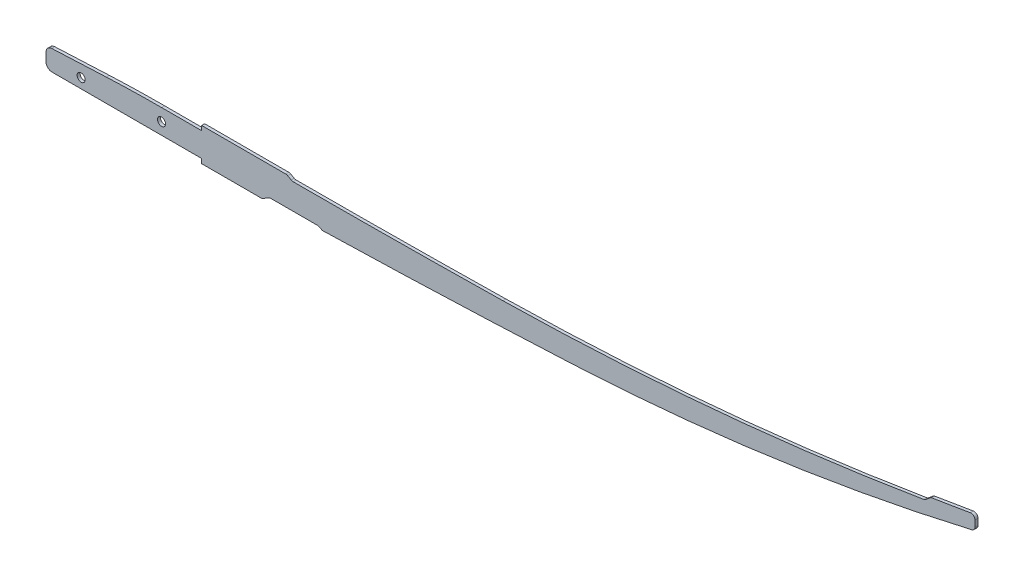
from build123d import *

# Parameters (mm, degrees)
SKETCH_1_R      = 4.01
EXTRUDE_1_DEPTH = 1.5
FILLET_1_R      = 4
FILLET_3_R      = 4


with BuildPart() as part:
    # 草图1 → 凸台-拉伸1 (new, symmetric)
    with BuildSketch(Plane.XY):
        with BuildLine():
            Line((84.803847577, 16.5), (0, 16.5))
            Line((0, 16.5), (0, 12))
            Line((0, 12), (-40, 12))
            ThreePointArc((-40, 12), (-67.507177593, 11.685785822), (-95, 10.743307267))
            Line((-95, 10.743307267), (-149.274044434, 8.261800925))
            ThreePointArc((-149.274044434, 8.261800925), (-153.33844826, 6.41268156), (-155, 2.268062555))
            Line((-155, 2.268062555), (-155, -6))
            ThreePointArc((-155, -6), (-153.242640687, -10.242640687), (-149, -12))
            Line((-149, -12), (0, -12))
            Line((0, -12), (0, -16.5))
            Line((0, -16.5), (60, -16.5))
            Line((60, -16.5), (67.794228634, -12))
            Line((67.794228634, -12), (116.535898385, -12))
            Line((116.535898385, -12), (120, -14))
            ThreePointArc((120, -14), (245.029335454, -10.091641658), (370, -4.619622641))
            ThreePointArc((370, -4.619622641), (571.283338748, 14.623800116), (770, 52))
            Line((770, 52), (770, 66))
            Line((770, 66), (726.095384123, 58.705604999))
            Line((726.095384123, 58.705604999), (720, 53.69290648))
            ThreePointArc((720, 53.69290648), (510.7057538, 26.787088429), (300, 15.337640705))
            ThreePointArc((300, 15.337640705), (195.00402007, 13.959418971), (90, 13.5))
            Line((90, 13.5), (84.803847577, 16.5))
        make_face()
        with Locations((-120, -2.211052686)):
            Circle(SKETCH_1_R, mode=Mode.SUBTRACT)
        with Locations((-40.000682679, -0.212893311)):
            Circle(SKETCH_1_R, mode=Mode.SUBTRACT)
    extrude(amount=EXTRUDE_1_DEPTH, both=True)

    # 圆角1
    fillet_1_edges = [part.edges().sort_by_distance(p)[0] for p in [
        (770, 66, 0),
        (770, 52, 0),
    ]]
    fillet(fillet_1_edges, radius=FILLET_1_R)

    # 圆角3
    fillet_3_edges = [part.edges().sort_by_distance(p)[0] for p in [
        (720, 53.69290648, 0),
        (726.095384123, 58.705604999, 0),
        (90, 13.5, 0),
        (84.803847577, 16.5, 0),
        (120, -14, 0),
        (116.535898385, -12, 0),
        (67.794228634, -12, 0),
        (60, -16.5, 0),
    ]]
    fillet(fillet_3_edges, radius=FILLET_3_R)


solid = part.part
